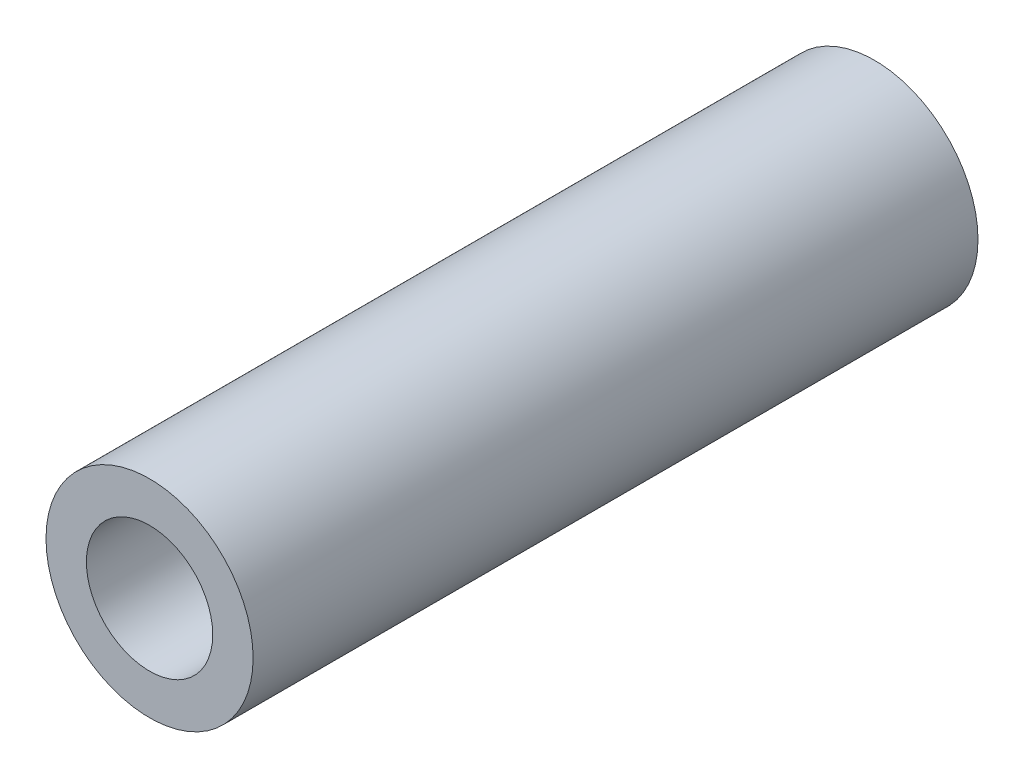
from build123d import *

# Parameters (mm, degrees)
SKETCH2_R           = 10
SKETCH2_R_2         = 6.1
BOSS_EXTRUDE1_DEPTH = 25
SKETCH3_R           = 10
BOSS_EXTRUDE2_DEPTH = 45
CUT_EXTRUDE1_START  = -45
SKETCH4_R           = 6.1
CUT_EXTRUDE1_DEPTH  = 45


with BuildPart() as part:
    # Sketch2 → Boss-Extrude1 (new body)
    with BuildSketch(Plane.XY):
        Circle(SKETCH2_R)
        Circle(SKETCH2_R_2, mode=Mode.SUBTRACT)
    extrude(amount=BOSS_EXTRUDE1_DEPTH)

    # Sketch3 → Boss-Extrude2 (add)
    with BuildSketch(Plane.XY.offset(25)):
        Circle(SKETCH3_R)
    extrude(amount=BOSS_EXTRUDE2_DEPTH)

    # Sketch4 → Cut-Extrude1 (cut)
    with BuildSketch(Plane.XY.offset(70).offset(CUT_EXTRUDE1_START)):
        Circle(SKETCH4_R)
    extrude(amount=CUT_EXTRUDE1_DEPTH, mode=Mode.SUBTRACT)


solid = part.part
